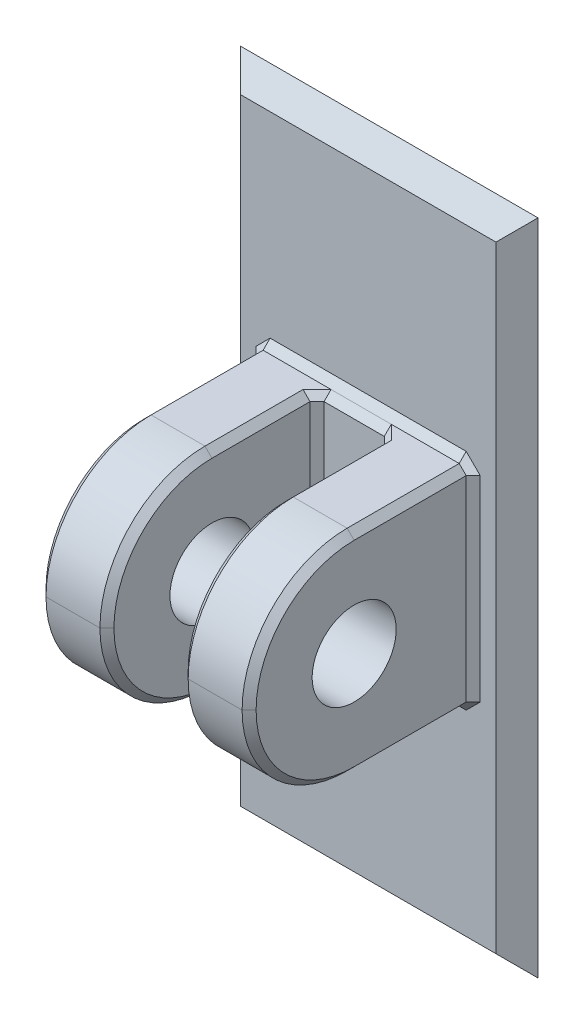
from build123d import *

# Parameters (mm, degrees)
SKETCH1_W               = 21.25
SKETCH1_H               = 47
BOSS_EXTRUDE1_DEPTH     = 1.5
CHAMFER1_SIZE           = 1.5
SKETCH2_W               = 15
SKETCH2_H               = 15
BOSS_EXTRUDE2_DEPTH     = 16
SKETCH3_W               = 5.3
SKETCH3_H               = 15
CUT_EXTRUDE1_DEPTH      = 15
CUT_EXTRUDE2_DEPTH      = 35.453093112
CUT_EXTRUDE2_DEPTH_BACK = 35.453093112
SKETCH4_R               = 3
FILLET1_R               = 7.5
CHAMFER2_SIZE           = 0.5


with BuildPart() as part:
    # Sketch1 → Boss-Extrude1 (new body)
    with BuildSketch(Plane.XY):
        Rectangle(SKETCH1_W, SKETCH1_H)
    extrude(amount=BOSS_EXTRUDE1_DEPTH)

    # Chamfer1
    chamfer1_edges = [part.edges().sort_by_distance(p)[0] for p in [
        (0, -23.5, 1.5),
        (-10.625, 0, 1.5),
        (0, 23.5, 1.5),
        (10.625, 0, 1.5),
    ]]
    chamfer(chamfer1_edges, length=CHAMFER1_SIZE - 0.0001)  # a hair under: the kernel refuses the full size

    # Sketch2 → Boss-Extrude2 (add)
    with BuildSketch(Plane.XY.offset(1.5)):
        Rectangle(SKETCH2_W, SKETCH2_H)
    extrude(amount=BOSS_EXTRUDE2_DEPTH)

    # Sketch3 → Cut-Extrude1 (cut)
    with BuildSketch(Plane.XY.offset(17.5)):
        Rectangle(SKETCH3_W, SKETCH3_H)
    extrude(amount=-CUT_EXTRUDE1_DEPTH, mode=Mode.SUBTRACT)

    # Sketch4 → Cut-Extrude2 (cut, two sides: drawn at the far end of the back side and taken through both)
    with BuildSketch(Plane.ZY.offset(7.5).offset(-CUT_EXTRUDE2_DEPTH_BACK)):
        with Locations((10, 0)):
            Circle(SKETCH4_R)
    extrude(amount=CUT_EXTRUDE2_DEPTH + CUT_EXTRUDE2_DEPTH_BACK, mode=Mode.SUBTRACT)

    # Fillet1
    fillet1_edges = [part.edges().sort_by_distance(p)[0] for p in [
        (5.075, -7.5, 17.5),
        (5.075, 7.5, 17.5),
        (-5.075, 7.5, 17.5),
        (-5.075, -7.5, 17.5),
    ]]
    fillet(fillet1_edges, radius=FILLET1_R - 0.0001)  # a hair under: the kernel refuses the full size

    # Chamfer2
    chamfer2_edges = [part.edges().sort_by_distance(p)[0] for p in [
        (7.5, 0, 1.5),
        (0, 7.5, 1.5),
        (-7.5, 0, 1.5),
        (0, -7.5, 1.5),
        (2.65, 0, 2.5),
        (2.65, 7.5, 6.25005),
        (0, -7.5, 2.5),
        (2.65, -7.5, 6.25005),
        (-2.65, 0, 2.5),
        (-2.65, -7.5, 6.25005),
        (0, 7.5, 2.5),
        (-2.65, 7.5, 6.25005),
        (7.5, 7.5, 5.75005),
        (7.5, -7.5, 5.75005),
        (7.5, 5.303330148, 15.303330148),
        (7.5, -5.303330148, 15.303330148),
        (-7.5, -7.5, 5.75005),
        (2.65, 5.303330148, 15.303330148),
        (2.65, -5.303330148, 15.303330148),
        (-7.5, 7.5, 5.75005),
        (-7.5, -5.303330148, 15.303330148),
        (-7.5, 5.303330148, 15.303330148),
        (-2.65, -5.303330148, 15.303330148),
        (-2.65, 5.303330148, 15.303330148),
    ]]
    chamfer(chamfer2_edges, length=CHAMFER2_SIZE - 0.0001)  # a hair under: the kernel refuses the full size


solid = part.part
